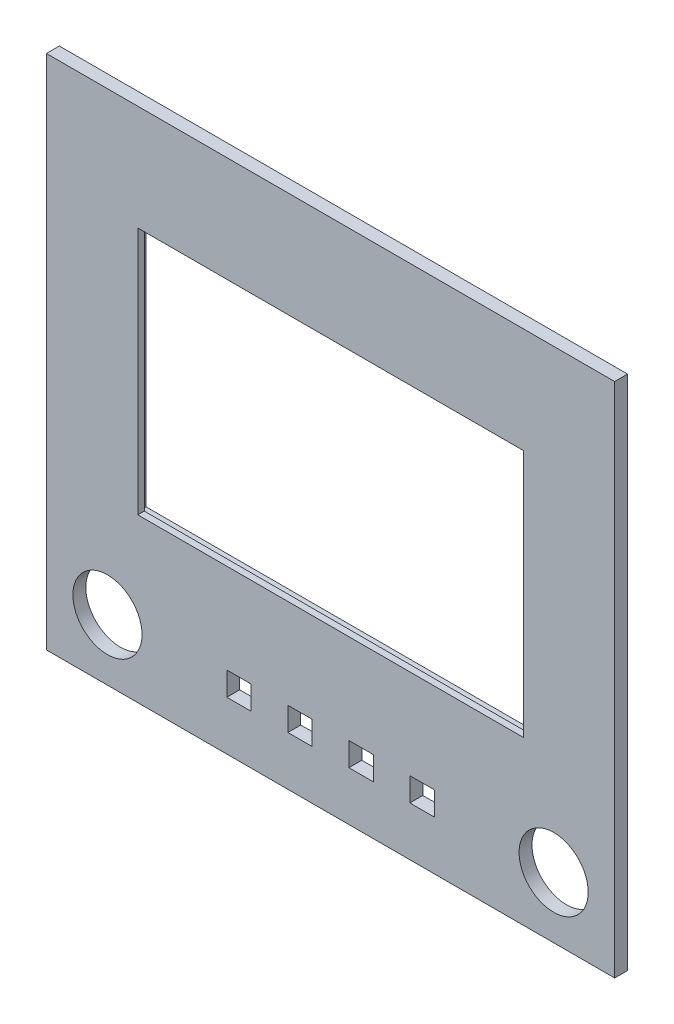
from build123d import *

# Parameters (mm, degrees)
SKETCH1_W           = 139.7
SKETCH1_H           = 127
SKETCH1_R           = 8.5
SKETCH1_W_2         = 6
SKETCH1_H_2         = 5.8
SKETCH1_W_3         = 94.77
SKETCH1_H_3         = 61.08
BOSS_EXTRUDE1_DEPTH = 3.175
SKETCH3_W           = 97
SKETCH3_H           = 62
SKETCH3_W_2         = 94.77
SKETCH3_H_2         = 61.08
CUT_EXTRUDE1_DEPTH  = 1.5875


with BuildPart() as part:
    # Sketch1 → Boss-Extrude1 (new body)
    with BuildSketch(Plane.XY):
        with Locations((0, -7.04)):
            Rectangle(SKETCH1_W, SKETCH1_H)
        with Locations((-54.85, -55.54)):
            Circle(SKETCH1_R, mode=Mode.SUBTRACT)
        with Locations((54.85, -55.54)):
            Circle(SKETCH1_R, mode=Mode.SUBTRACT)
        with Locations((-7.5, -55.54)):
            Rectangle(SKETCH1_W_2, SKETCH1_H_2, mode=Mode.SUBTRACT)
        Rectangle(SKETCH1_W_3, SKETCH1_H_3, mode=Mode.SUBTRACT)
        with Locations((-22.5, -55.54)):
            Rectangle(SKETCH1_W_2, SKETCH1_H_2, mode=Mode.SUBTRACT)
        with Locations((7.5, -55.54)):
            Rectangle(SKETCH1_W_2, SKETCH1_H_2, mode=Mode.SUBTRACT)
        with Locations((22.5, -55.54)):
            Rectangle(SKETCH1_W_2, SKETCH1_H_2, mode=Mode.SUBTRACT)
    extrude(amount=BOSS_EXTRUDE1_DEPTH)

    # Sketch3 → Cut-Extrude1 (cut)
    with BuildSketch(Plane(origin=(0, 0, 0), x_dir=(-1, 0, 0), z_dir=(0, 0, -1))):
        Rectangle(SKETCH3_W, SKETCH3_H)
        Rectangle(SKETCH3_W_2, SKETCH3_H_2, mode=Mode.SUBTRACT)
    extrude(amount=-CUT_EXTRUDE1_DEPTH, mode=Mode.SUBTRACT)


solid = part.part
